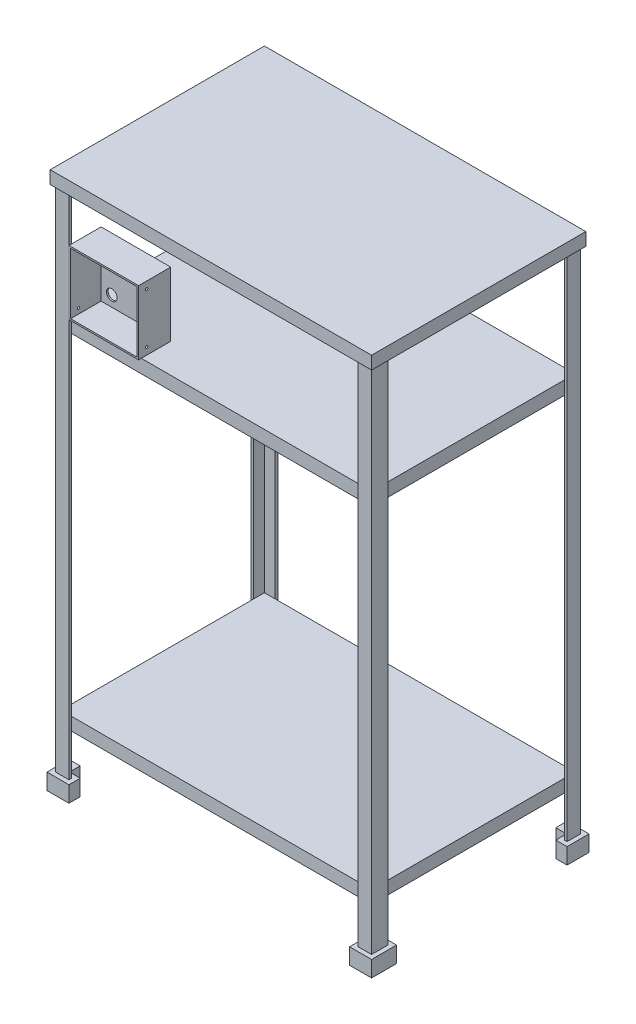
from build123d import *

# Parameters (mm, degrees)
CROQUIS1_W                       = 600
CROQUIS1_H                       = 400
SALIENTE_EXTRUIR1_DEPTH          = 4
CROQUIS2_W                       = 600
CROQUIS2_H                       = 400
CROQUIS2_W_2                     = 590
CROQUIS2_H_2                     = 390
SALIENTE_EXTRUIR2_DEPTH          = 20
SALIENTE_EXTRUIR3_DEPTH          = 1000
SALIENTE_EXTRUIR4_DEPTH          = 30
CROQUIS5_W                       = 580
CROQUIS5_H                       = 25
CROQUIS5_H_2                     = 24
SALIENTE_EXTRUIR5_DEPTH          = 380
CORTAR_EXTRUIR2_DEPTH            = 18
CROQUIS8_W                       = 130
CROQUIS8_H                       = 120
SALIENTE_EXTRUIR6_DEPTH          = 60
VACIADO1_T                       = -3
S_LIDO_MOVER_COPIAR1_START       = -282.5
S_LIDO_MOVER_COPIAR1_OUTLINE_W   = 120
S_LIDO_MOVER_COPIAR1_OUTLINE_H   = 60
S_LIDO_MOVER_COPIAR1_DEPTH       = 12.5
S_LIDO_MOVER_COPIAR1_START_2     = -155.5
S_LIDO_MOVER_COPIAR1_2_OUTLINE_W = 114
S_LIDO_MOVER_COPIAR1_2_OUTLINE_H = 57
S_LIDO_MOVER_COPIAR1_2_DEPTH     = 3
S_LIDO_MOVER_COPIAR1_START_3     = -143
S_LIDO_MOVER_COPIAR1_3_OUTLINE_W = 120
S_LIDO_MOVER_COPIAR1_3_OUTLINE_H = 60
S_LIDO_MOVER_COPIAR1_3_DEPTH     = 3
S_LIDO_MOVER_COPIAR1_START_4     = -270
S_LIDO_MOVER_COPIAR1_4_OUTLINE_W = 114
S_LIDO_MOVER_COPIAR1_4_OUTLINE_H = 57
S_LIDO_MOVER_COPIAR1_4_DEPTH     = 3
S_LIDO_MOVER_COPIAR1_START_5     = -152.5
S_LIDO_MOVER_COPIAR1_5_DEPTH     = 9.5
CROQUIS11_R                      = 10
CROQUIS11_R_2                    = 7.5
CORTAR_EXTRUIR3_DEPTH            = 10
CROQUIS12_R                      = 2.25
CORTAR_EXTRUIR4_DEPTH            = 190


# Read off the part's stored shape, not the designer's step: Sólido-Mover/Copiar1
with BuildPart() as part:
    # Croquis1 → Saliente-Extruir1 (new body)
    with BuildSketch(Plane(origin=(0, 0, 0), x_dir=(1, 0, 0), z_dir=(0, 1, 0))):
        Rectangle(CROQUIS1_W, CROQUIS1_H)
    extrude(amount=SALIENTE_EXTRUIR1_DEPTH)

    # Croquis2 → Saliente-Extruir2 (add)
    with BuildSketch(Plane.XZ):
        Rectangle(CROQUIS2_W, CROQUIS2_H)
        Rectangle(CROQUIS2_W_2, CROQUIS2_H_2, mode=Mode.SUBTRACT)
    extrude(amount=SALIENTE_EXTRUIR2_DEPTH)

    # Croquis3 → Saliente-Extruir3 (add)
    with BuildSketch(Plane.XZ):
        Polygon((-270, 190), (-290, 190), (-290, 170), (-295, 170), (-295, 195), (-270, 195), align=None)
        Polygon((270, 195), (295, 195), (295, 164.340926839), (290, 164.340926839), (290, 190), (270, 190), align=None)
        Polygon((270, -195), (295, -195), (295, -170), (290, -170), (290, -190), (270, -190), align=None)
        Polygon((-295, -170), (-295, -195), (-270, -195), (-270, -190), (-290, -190), (-290, -170), align=None)
    extrude(amount=SALIENTE_EXTRUIR3_DEPTH)

    # Croquis4 → Saliente-Extruir4 (add)
    # profile 1 of 4: a face of its own
    with BuildSketch(Plane.XZ.offset(1000)):
        Polygon((-303, 203), (-303, 162), (-282, 162), (-282, 182), (-262, 182), (-262, 203), align=None)
        Polygon((-295, 195), (-295, 170), (-290, 170), (-290, 190), (-270, 190), (-270, 195), align=None, mode=Mode.SUBTRACT)
    # profile 2 of 4: a face of its own
    with BuildSketch(Plane.XZ.offset(1000)):
        Polygon((-282, -162), (-303, -162), (-303, -203), (-262, -203), (-262, -182), (-282, -182), align=None)
        Polygon((-290, -170), (-295, -170), (-295, -195), (-270, -195), (-270, -190), (-290, -190), align=None, mode=Mode.SUBTRACT)
    # profile 3 of 4: a face of its own
    with BuildSketch(Plane.XZ.offset(1000)):
        Polygon((262, 203), (262, 182), (282, 182), (282, 156.340926839), (303, 156.340926839), (303, 203), align=None)
        Polygon((270, 195), (270, 190), (290, 190), (290, 164.340926839), (295, 164.340926839), (295, 195), align=None, mode=Mode.SUBTRACT)
    # profile 4 of 4: a face of its own
    with BuildSketch(Plane.XZ.offset(1000)):
        Polygon((262, -182), (262, -203), (303, -203), (303, -162), (282, -162), (282, -182), align=None)
        Polygon((270, -190), (270, -195), (295, -195), (295, -170), (290, -170), (290, -190), align=None, mode=Mode.SUBTRACT)
    extrude(amount=-SALIENTE_EXTRUIR4_DEPTH)

    # Croquis5 → Saliente-Extruir5 (add)
    with BuildSketch(Plane.XY.offset(-190)):
        with Locations((0, -238.5)):
            Rectangle(CROQUIS5_W, CROQUIS5_H)
        with Locations((0, -882)):
            Rectangle(CROQUIS5_W, CROQUIS5_H_2)
    extrude(amount=SALIENTE_EXTRUIR5_DEPTH)

    # Croquis7 → Cortar-Extruir2 (cut)
    with BuildSketch(Plane.XZ.offset(894)):
        Polygon((-270, 185), (-285, 185), (-285, 170), (-285, -170), (-285, -185), (-270, -185), (270, -185), (285, -185), (285, -170), (285, 164.340926839), (285, 185), (270, 185), align=None)
    extrude(amount=-CORTAR_EXTRUIR2_DEPTH, mode=Mode.SUBTRACT)


with BuildPart() as body_2:
    # Croquis8 → Saliente-Extruir6 (new body)
    with BuildSketch(Plane.XY.offset(195)):
        with Locations((-217.5, -166)):
            Rectangle(CROQUIS8_W, CROQUIS8_H)
    extrude(amount=-SALIENTE_EXTRUIR6_DEPTH)

    # Vaciado1
    vaciado1_openings = [body_2.faces().sort_by_distance(p)[0] for p in [
        (-217.5, -166, 195),
    ]]
    offset(amount=VACIADO1_T, openings=vaciado1_openings, kind=Kind.INTERSECTION)

    # Sólido-Mover/Copiar1 outline → Sólido-Mover/Copiar1 (cut)
    with BuildSketch(Plane.YZ.offset(S_LIDO_MOVER_COPIAR1_START)):
        with Locations((-166, 165)):
            Rectangle(S_LIDO_MOVER_COPIAR1_OUTLINE_W, S_LIDO_MOVER_COPIAR1_OUTLINE_H)
    extrude(amount=S_LIDO_MOVER_COPIAR1_DEPTH, mode=Mode.SUBTRACT)

    # S_lido-Mover_Copiar1 2 outline → S_lido-Mover_Copiar1 2 (cut)
    with BuildSketch(Plane.YZ.offset(S_LIDO_MOVER_COPIAR1_START_2)):
        with Locations((-166, 166.5)):
            Rectangle(S_LIDO_MOVER_COPIAR1_2_OUTLINE_W, S_LIDO_MOVER_COPIAR1_2_OUTLINE_H)
    extrude(amount=S_LIDO_MOVER_COPIAR1_2_DEPTH, mode=Mode.SUBTRACT)

    # S_lido-Mover_Copiar1 3 outline → S_lido-Mover_Copiar1 3 (add)
    with BuildSketch(Plane.YZ.offset(S_LIDO_MOVER_COPIAR1_START_3)):
        with Locations((-166, 165)):
            Rectangle(S_LIDO_MOVER_COPIAR1_3_OUTLINE_W, S_LIDO_MOVER_COPIAR1_3_OUTLINE_H)
    extrude(amount=S_LIDO_MOVER_COPIAR1_3_DEPTH)

    # S_lido-Mover_Copiar1 4 outline → S_lido-Mover_Copiar1 4 (add)
    with BuildSketch(Plane.YZ.offset(S_LIDO_MOVER_COPIAR1_START_4)):
        with Locations((-166, 166.5)):
            Rectangle(S_LIDO_MOVER_COPIAR1_4_OUTLINE_W, S_LIDO_MOVER_COPIAR1_4_OUTLINE_H)
    extrude(amount=S_LIDO_MOVER_COPIAR1_4_DEPTH)

    # S_lido-Mover_Copiar1 5 outline → S_lido-Mover_Copiar1 5 (add)
    with BuildSketch(Plane.YZ.offset(S_LIDO_MOVER_COPIAR1_START_5)):
        Polygon((-106, 135), (-106, 195), (-109, 195), (-109, 138), (-223, 138), (-223, 195), (-226, 195), (-226, 135), align=None)
    extrude(amount=S_LIDO_MOVER_COPIAR1_5_DEPTH)

    # Croquis11 → Cortar-Extruir3 (cut)
    with BuildSketch(Plane.XY.offset(138)):
        with Locations((-247, -203)):
            Circle(CROQUIS11_R)
        with Locations((-247, -124)):
            Circle(CROQUIS11_R_2)
        with Locations((-217, -124)):
            Circle(CROQUIS11_R_2)
    extrude(amount=-CORTAR_EXTRUIR3_DEPTH, mode=Mode.SUBTRACT)

    # Croquis12 → Cortar-Extruir4 (cut)
    with BuildSketch(Plane(origin=(-140, 0, 0), x_dir=(0, 0, -1), z_dir=(1, 0, 0))):
        with Locations(Location((-180, -119, 0), (0, 0, 90))):
            Circle(CROQUIS12_R)
        with Locations(Location((-180, -213, 0), (0, 0, 90))):
            Circle(CROQUIS12_R)
    extrude(amount=-CORTAR_EXTRUIR4_DEPTH, mode=Mode.SUBTRACT)


solid = Compound([part.part, body_2.part])
